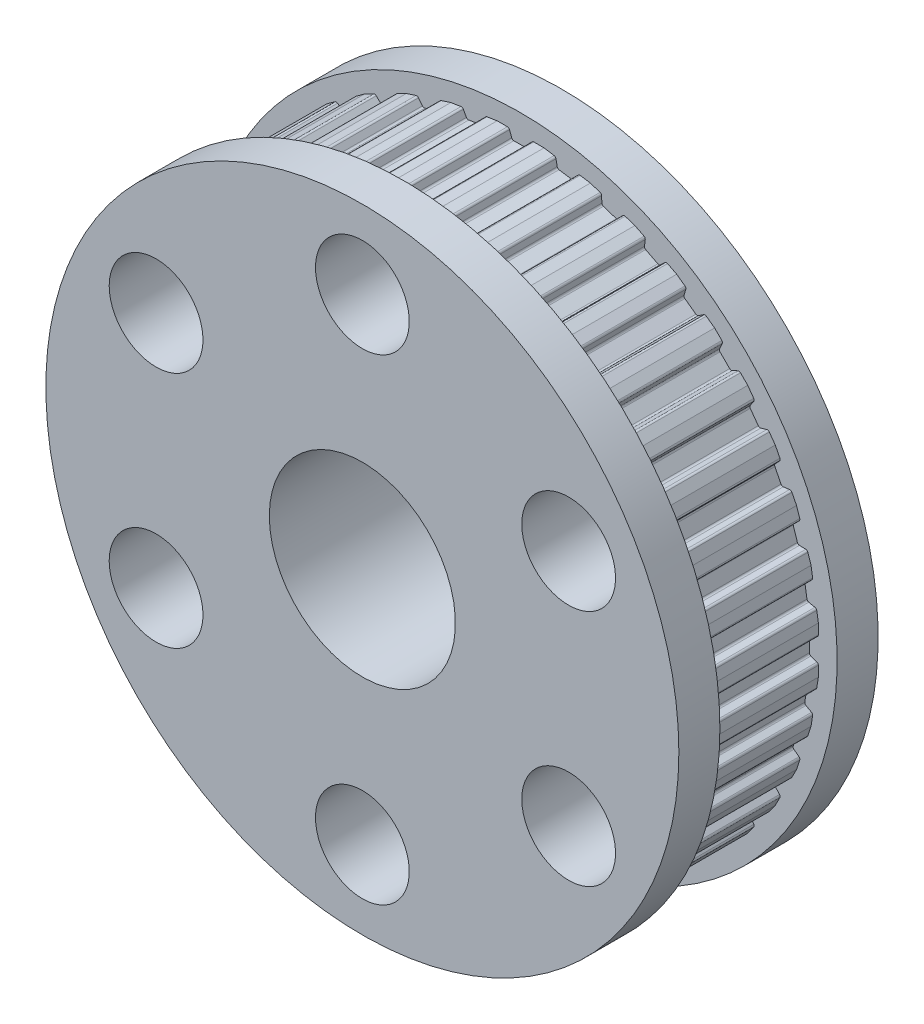
from build123d import *

# Parameters (mm, degrees)
BOSS_EXTRUDE1_DEPTH         = 5
SKETCH3_R                   = 13.5
BOSS_EXTRUDE2_DEPTH         = 1.75
BOSS_EXTRUDE3_START         = 1.75
SKETCH4_R                   = 13.5
BOSS_EXTRUDE3_DEPTH         = 1.75
F_5_16_0_3125_DOWEL_HOLE2_D = 7.9375
F_4_0MM_DOWEL_HOLE1_D       = 4
CIRPATTERN1_COUNT           = 6


with BuildPart() as part:
    # Sketch1 → Boss-Extrude1 (new body)
    with BuildSketch(Plane.XY):
        with BuildLine():
            Line((-50.783511677, 0), (-50.346633156, 0))
            ThreePointArc((-50.346633156, 0), (-50.292, 0.017225768), (-50.257127433, 0.062672581))
            Line((-50.257127433, 0.062672581), (-50.164076682, 0.318327419))
            ThreePointArc((-50.164076682, 0.318327419), (-50.129204116, 0.363774232), (-50.07457096, 0.381))
            Line((-50.07457096, 0.381), (-49.49342904, 0.381))
            ThreePointArc((-49.49342904, 0.381), (-49.438795884, 0.363774232), (-49.403923318, 0.318327419))
            Line((-49.403923318, 0.318327419), (-49.310872567, 0.062672581))
            ThreePointArc((-49.310872567, 0.062672581), (-49.276, 0.017225768), (-49.221366844, 0))
            Line((-49.221366844, 0), (-48.784488323, 0))
            Line((-48.784488323, 0), (-48.352988502, 0.068342858))
            ThreePointArc((-48.352988502, 0.068342858), (-48.301722675, 0.093903056), (-48.274388895, 0.144245615))
            Line((-48.274388895, 0.144245615), (-48.222476981, 0.411309262))
            ThreePointArc((-48.222476981, 0.411309262), (-48.195143202, 0.461651821), (-48.143877375, 0.487212019))
            Line((-48.143877375, 0.487212019), (-47.569890276, 0.578122645))
            ThreePointArc((-47.569890276, 0.578122645), (-47.513235041, 0.569655463), (-47.471682366, 0.530223447))
            Line((-47.471682366, 0.530223447), (-47.339783996, 0.292272489))
            ThreePointArc((-47.339783996, 0.292272489), (-47.298231321, 0.252840473), (-47.241576086, 0.244373291))
            Line((-47.241576086, 0.244373291), (-46.810076265, 0.312716149))
            Line((-46.810076265, 0.312716149), (-46.3945801, 0.447719036))
            ThreePointArc((-46.3945801, 0.447719036), (-46.347943937, 0.480984289), (-46.328821993, 0.534982993))
            Line((-46.328821993, 0.534982993), (-46.319327159, 0.806879455))
            ThreePointArc((-46.319327159, 0.806879455), (-46.300205215, 0.860878159), (-46.253569052, 0.894143411))
            Line((-46.253569052, 0.894143411), (-45.700870241, 1.073726141))
            ThreePointArc((-45.700870241, 1.073726141), (-45.643587967, 1.074226035), (-45.596378348, 1.041779763))
            Line((-45.596378348, 1.041779763), (-45.428880136, 0.827391827))
            ThreePointArc((-45.428880136, 0.827391827), (-45.381670516, 0.794945555), (-45.324388243, 0.79544545))
            Line((-45.324388243, 0.79544545), (-44.908892078, 0.930448337))
            Line((-44.908892078, 0.930448337), (-44.519630466, 1.128787035))
            ThreePointArc((-44.519630466, 1.128787035), (-44.478772303, 1.16893824), (-44.46833304, 1.225263462))
            Line((-44.46833304, 1.225263462), (-44.501489081, 1.495297747))
            ThreePointArc((-44.501489081, 1.495297747), (-44.491049818, 1.551622968), (-44.450191655, 1.591774173))
            Line((-44.450191655, 1.591774173), (-43.932390412, 1.855607084))
            ThreePointArc((-43.932390412, 1.855607084), (-43.875891579, 1.865061746), (-43.824187473, 1.840400153))
            Line((-43.824187473, 1.840400153), (-43.62521378, 1.654854182))
            ThreePointArc((-43.62521378, 1.654854182), (-43.573509674, 1.630192588), (-43.517010841, 1.63964725))
            Line((-43.517010841, 1.63964725), (-43.127749228, 1.837985948))
            Line((-43.127749228, 1.837985948), (-42.77430708, 2.0947767))
            ThreePointArc((-42.77430708, 2.0947767), (-42.740232981, 2.140825202), (-42.738733449, 2.198090027))
            Line((-42.738733449, 2.198090027), (-42.813723953, 2.459612994))
            ThreePointArc((-42.813723953, 2.459612994), (-42.812224421, 2.516877819), (-42.778150322, 2.562926321))
            Line((-42.778150322, 2.562926321), (-42.307996632, 2.904512971))
            ThreePointArc((-42.307996632, 2.904512971), (-42.253672429, 2.922689596), (-42.198746963, 2.906419932))
            Line((-42.198746963, 2.906419932), (-41.973197181, 2.754284683))
            ThreePointArc((-41.973197181, 2.754284683), (-41.918271715, 2.738015018), (-41.863947511, 2.756191643))
            Line((-41.863947511, 2.756191643), (-41.510505363, 3.012982394))
            Line((-41.510505363, 3.012982394), (-41.201585599, 3.321902159))
            ThreePointArc((-41.201585599, 3.321902159), (-41.175134581, 3.372714091), (-41.182611703, 3.42950847))
            Line((-41.182611703, 3.42950847), (-41.297590155, 3.676080556))
            ThreePointArc((-41.297590155, 3.676080556), (-41.305067277, 3.732874934), (-41.278616259, 3.783686866))
            Line((-41.278616259, 3.783686866), (-40.867686866, 4.194616259))
            ThreePointArc((-40.867686866, 4.194616259), (-40.816874934, 4.221067277), (-40.760080556, 4.213590155))
            Line((-40.760080556, 4.213590155), (-40.51350847, 4.098611703))
            ThreePointArc((-40.51350847, 4.098611703), (-40.456714091, 4.091134581), (-40.405902159, 4.117585599))
            Line((-40.405902159, 4.117585599), (-40.096982394, 4.426505363))
            Line((-40.096982394, 4.426505363), (-39.840191643, 4.779947511))
            ThreePointArc((-39.840191643, 4.779947511), (-39.822015018, 4.834271715), (-39.838284683, 4.889197181))
            Line((-39.838284683, 4.889197181), (-39.990419932, 5.114746963))
            ThreePointArc((-39.990419932, 5.114746963), (-40.006689596, 5.169672429), (-39.988512971, 5.223996632))
            Line((-39.988512971, 5.223996632), (-39.646926321, 5.694150322))
            ThreePointArc((-39.646926321, 5.694150322), (-39.600877819, 5.728224421), (-39.543612994, 5.729723953))
            Line((-39.543612994, 5.729723953), (-39.282090027, 5.654733449))
            ThreePointArc((-39.282090027, 5.654733449), (-39.224825202, 5.656232981), (-39.1787767, 5.69030708))
            Line((-39.1787767, 5.69030708), (-38.921985948, 6.043749228))
            Line((-38.921985948, 6.043749228), (-38.72364725, 6.433010841))
            ThreePointArc((-38.72364725, 6.433010841), (-38.714192588, 6.489509674), (-38.738854182, 6.54121378))
            Line((-38.738854182, 6.54121378), (-38.924400153, 6.740187473))
            ThreePointArc((-38.924400153, 6.740187473), (-38.949061746, 6.791891579), (-38.939607084, 6.848390412))
            Line((-38.939607084, 6.848390412), (-38.675774173, 7.366191655))
            ThreePointArc((-38.675774173, 7.366191655), (-38.635622968, 7.407049818), (-38.579297747, 7.417489081))
            Line((-38.579297747, 7.417489081), (-38.309263462, 7.38433304))
            ThreePointArc((-38.309263462, 7.38433304), (-38.25293824, 7.394772303), (-38.212787035, 7.435630466))
            Line((-38.212787035, 7.435630466), (-38.014448337, 7.824892078))
            Line((-38.014448337, 7.824892078), (-37.87944545, 8.240388243))
            ThreePointArc((-37.87944545, 8.240388243), (-37.878945555, 8.297670516), (-37.911391827, 8.344880136))
            Line((-37.911391827, 8.344880136), (-38.125779763, 8.512378348))
            ThreePointArc((-38.125779763, 8.512378348), (-38.158226035, 8.559587967), (-38.157726141, 8.616870241))
            Line((-38.157726141, 8.616870241), (-37.978143411, 9.169569052))
            ThreePointArc((-37.978143411, 9.169569052), (-37.944878159, 9.216205215), (-37.890879455, 9.235327159))
            Line((-37.890879455, 9.235327159), (-37.618982993, 9.244821993))
            ThreePointArc((-37.618982993, 9.244821993), (-37.564984289, 9.263943937), (-37.531719036, 9.3105801))
            Line((-37.531719036, 9.3105801), (-37.396716149, 9.726076265))
            Line((-37.396716149, 9.726076265), (-37.328373291, 10.157576086))
            ThreePointArc((-37.328373291, 10.157576086), (-37.336840473, 10.214231321), (-37.376272489, 10.255783996))
            Line((-37.376272489, 10.255783996), (-37.614223447, 10.387682366))
            ThreePointArc((-37.614223447, 10.387682366), (-37.653655463, 10.429235041), (-37.662122645, 10.485890276))
            Line((-37.662122645, 10.485890276), (-37.571212019, 11.059877375))
            ThreePointArc((-37.571212019, 11.059877375), (-37.545651821, 11.111143202), (-37.495309262, 11.138476981))
            Line((-37.495309262, 11.138476981), (-37.228245615, 11.190388895))
            ThreePointArc((-37.228245615, 11.190388895), (-37.177903056, 11.217722675), (-37.152342858, 11.268988502))
            Line((-37.152342858, 11.268988502), (-37.084, 11.700488323))
            Line((-37.084, 11.700488323), (-37.084, 12.137366844))
            ThreePointArc((-37.084, 12.137366844), (-37.101225768, 12.192), (-37.146672581, 12.226872567))
            Line((-37.146672581, 12.226872567), (-37.402327419, 12.319923318))
            ThreePointArc((-37.402327419, 12.319923318), (-37.447774232, 12.354795884), (-37.465, 12.40942904))
            Line((-37.465, 12.40942904), (-37.465, 12.99057096))
            ThreePointArc((-37.465, 12.99057096), (-37.447774232, 13.045204116), (-37.402327419, 13.080076682))
            Line((-37.402327419, 13.080076682), (-37.146672581, 13.173127433))
            ThreePointArc((-37.146672581, 13.173127433), (-37.101225768, 13.208), (-37.084, 13.262633156))
            Line((-37.084, 13.262633156), (-37.084, 13.699511677))
            Line((-37.084, 13.699511677), (-37.152342858, 14.131011498))
            ThreePointArc((-37.152342858, 14.131011498), (-37.177903056, 14.182277325), (-37.228245615, 14.209611105))
            Line((-37.228245615, 14.209611105), (-37.495309262, 14.261523019))
            ThreePointArc((-37.495309262, 14.261523019), (-37.545651821, 14.288856798), (-37.571212019, 14.340122625))
            Line((-37.571212019, 14.340122625), (-37.662122645, 14.914109724))
            ThreePointArc((-37.662122645, 14.914109724), (-37.653655463, 14.970764959), (-37.614223447, 15.012317634))
            Line((-37.614223447, 15.012317634), (-37.376272489, 15.144216004))
            ThreePointArc((-37.376272489, 15.144216004), (-37.336840473, 15.185768679), (-37.328373291, 15.242423914))
            Line((-37.328373291, 15.242423914), (-37.396716149, 15.673923735))
            Line((-37.396716149, 15.673923735), (-37.531719036, 16.0894199))
            ThreePointArc((-37.531719036, 16.0894199), (-37.564984289, 16.136056063), (-37.618982993, 16.155178007))
            Line((-37.618982993, 16.155178007), (-37.890879455, 16.164672841))
            ThreePointArc((-37.890879455, 16.164672841), (-37.944878159, 16.183794785), (-37.978143411, 16.230430948))
            Line((-37.978143411, 16.230430948), (-38.157726141, 16.783129759))
            ThreePointArc((-38.157726141, 16.783129759), (-38.158226035, 16.840412033), (-38.125779763, 16.887621652))
            Line((-38.125779763, 16.887621652), (-37.911391827, 17.055119864))
            ThreePointArc((-37.911391827, 17.055119864), (-37.878945555, 17.102329484), (-37.87944545, 17.159611757))
            Line((-37.87944545, 17.159611757), (-38.014448337, 17.575107922))
            Line((-38.014448337, 17.575107922), (-38.212787035, 17.964369534))
            ThreePointArc((-38.212787035, 17.964369534), (-38.25293824, 18.005227697), (-38.309263462, 18.01566696))
            Line((-38.309263462, 18.01566696), (-38.579297747, 17.982510919))
            ThreePointArc((-38.579297747, 17.982510919), (-38.635622968, 17.992950182), (-38.675774173, 18.033808345))
            Line((-38.675774173, 18.033808345), (-38.939607084, 18.551609588))
            ThreePointArc((-38.939607084, 18.551609588), (-38.949061746, 18.608108421), (-38.924400153, 18.659812527))
            Line((-38.924400153, 18.659812527), (-38.738854182, 18.85878622))
            ThreePointArc((-38.738854182, 18.85878622), (-38.714192588, 18.910490326), (-38.72364725, 18.966989159))
            Line((-38.72364725, 18.966989159), (-38.921985948, 19.356250772))
            Line((-38.921985948, 19.356250772), (-39.1787767, 19.70969292))
            ThreePointArc((-39.1787767, 19.70969292), (-39.224825202, 19.743767019), (-39.282090027, 19.745266551))
            Line((-39.282090027, 19.745266551), (-39.543612994, 19.670276047))
            ThreePointArc((-39.543612994, 19.670276047), (-39.600877819, 19.671775579), (-39.646926321, 19.705849678))
            Line((-39.646926321, 19.705849678), (-39.988512971, 20.176003368))
            ThreePointArc((-39.988512971, 20.176003368), (-40.006689596, 20.230327571), (-39.990419932, 20.285253037))
            Line((-39.990419932, 20.285253037), (-39.838284683, 20.510802819))
            ThreePointArc((-39.838284683, 20.510802819), (-39.822015018, 20.565728285), (-39.840191643, 20.620052489))
            Line((-39.840191643, 20.620052489), (-40.096982394, 20.973494637))
            Line((-40.096982394, 20.973494637), (-40.405902159, 21.282414401))
            ThreePointArc((-40.405902159, 21.282414401), (-40.456714091, 21.308865419), (-40.51350847, 21.301388297))
            Line((-40.51350847, 21.301388297), (-40.760080556, 21.186409845))
            ThreePointArc((-40.760080556, 21.186409845), (-40.816874934, 21.178932723), (-40.867686866, 21.205383741))
            Line((-40.867686866, 21.205383741), (-41.278616259, 21.616313134))
            ThreePointArc((-41.278616259, 21.616313134), (-41.305067277, 21.667125066), (-41.297590155, 21.723919444))
            Line((-41.297590155, 21.723919444), (-41.182611703, 21.97049153))
            ThreePointArc((-41.182611703, 21.97049153), (-41.175134581, 22.027285909), (-41.201585599, 22.078097841))
            Line((-41.201585599, 22.078097841), (-41.510505363, 22.387017606))
            Line((-41.510505363, 22.387017606), (-41.863947511, 22.643808357))
            ThreePointArc((-41.863947511, 22.643808357), (-41.918271715, 22.661984982), (-41.973197181, 22.645715317))
            Line((-41.973197181, 22.645715317), (-42.198746963, 22.493580068))
            ThreePointArc((-42.198746963, 22.493580068), (-42.253672429, 22.477310404), (-42.307996632, 22.495487029))
            Line((-42.307996632, 22.495487029), (-42.778150322, 22.837073679))
            ThreePointArc((-42.778150322, 22.837073679), (-42.812224421, 22.883122181), (-42.813723953, 22.940387006))
            Line((-42.813723953, 22.940387006), (-42.738733449, 23.201909973))
            ThreePointArc((-42.738733449, 23.201909973), (-42.740232981, 23.259174798), (-42.77430708, 23.3052233))
            Line((-42.77430708, 23.3052233), (-43.127749228, 23.562014052))
            Line((-43.127749228, 23.562014052), (-43.517010841, 23.76035275))
            ThreePointArc((-43.517010841, 23.76035275), (-43.573509674, 23.769807412), (-43.62521378, 23.745145818))
            Line((-43.62521378, 23.745145818), (-43.824187473, 23.559599847))
            ThreePointArc((-43.824187473, 23.559599847), (-43.875891579, 23.534938254), (-43.932390412, 23.544392916))
            Line((-43.932390412, 23.544392916), (-44.450191655, 23.808225827))
            ThreePointArc((-44.450191655, 23.808225827), (-44.491049818, 23.848377032), (-44.501489081, 23.904702253))
            Line((-44.501489081, 23.904702253), (-44.46833304, 24.174736538))
            ThreePointArc((-44.46833304, 24.174736538), (-44.478772303, 24.23106176), (-44.519630466, 24.271212965))
            Line((-44.519630466, 24.271212965), (-44.908892078, 24.469551663))
            Line((-44.908892078, 24.469551663), (-45.324388243, 24.60455455))
            ThreePointArc((-45.324388243, 24.60455455), (-45.381670516, 24.605054445), (-45.428880136, 24.572608173))
            Line((-45.428880136, 24.572608173), (-45.596378348, 24.358220237))
            ThreePointArc((-45.596378348, 24.358220237), (-45.643587967, 24.325773965), (-45.700870241, 24.326273859))
            Line((-45.700870241, 24.326273859), (-46.253569052, 24.505856589))
            ThreePointArc((-46.253569052, 24.505856589), (-46.300205215, 24.539121841), (-46.319327159, 24.593120545))
            Line((-46.319327159, 24.593120545), (-46.328821993, 24.865017007))
            ThreePointArc((-46.328821993, 24.865017007), (-46.347943937, 24.919015711), (-46.3945801, 24.952280964))
            Line((-46.3945801, 24.952280964), (-46.810076265, 25.087283851))
            Line((-46.810076265, 25.087283851), (-47.241576086, 25.155626709))
            ThreePointArc((-47.241576086, 25.155626709), (-47.298231321, 25.147159527), (-47.339783996, 25.107727511))
            Line((-47.339783996, 25.107727511), (-47.471682366, 24.869776553))
            ThreePointArc((-47.471682366, 24.869776553), (-47.513235041, 24.830344537), (-47.569890276, 24.821877355))
            Line((-47.569890276, 24.821877355), (-48.143877375, 24.912787981))
            ThreePointArc((-48.143877375, 24.912787981), (-48.195143202, 24.938348179), (-48.222476981, 24.988690738))
            Line((-48.222476981, 24.988690738), (-48.274388895, 25.255754385))
            ThreePointArc((-48.274388895, 25.255754385), (-48.301722675, 25.306096944), (-48.352988502, 25.331657142))
            Line((-48.352988502, 25.331657142), (-48.784488323, 25.4))
            Line((-48.784488323, 25.4), (-49.221366844, 25.4))
            ThreePointArc((-49.221366844, 25.4), (-49.276, 25.382774232), (-49.310872567, 25.337327419))
            Line((-49.310872567, 25.337327419), (-49.403923318, 25.081672581))
            ThreePointArc((-49.403923318, 25.081672581), (-49.438795884, 25.036225768), (-49.49342904, 25.019))
            Line((-49.49342904, 25.019), (-50.07457096, 25.019))
            ThreePointArc((-50.07457096, 25.019), (-50.129204116, 25.036225768), (-50.164076682, 25.081672581))
            Line((-50.164076682, 25.081672581), (-50.257127433, 25.337327419))
            ThreePointArc((-50.257127433, 25.337327419), (-50.292, 25.382774232), (-50.346633156, 25.4))
            Line((-50.346633156, 25.4), (-50.783511677, 25.4))
            Line((-50.783511677, 25.4), (-51.215011498, 25.331657142))
            ThreePointArc((-51.215011498, 25.331657142), (-51.266277325, 25.306096944), (-51.293611105, 25.255754385))
            Line((-51.293611105, 25.255754385), (-51.345523019, 24.988690738))
            ThreePointArc((-51.345523019, 24.988690738), (-51.372856798, 24.938348179), (-51.424122625, 24.912787981))
            Line((-51.424122625, 24.912787981), (-51.998109724, 24.821877355))
            ThreePointArc((-51.998109724, 24.821877355), (-52.054764959, 24.830344537), (-52.096317634, 24.869776553))
            Line((-52.096317634, 24.869776553), (-52.228216004, 25.107727511))
            ThreePointArc((-52.228216004, 25.107727511), (-52.269768679, 25.147159527), (-52.326423914, 25.155626709))
            Line((-52.326423914, 25.155626709), (-52.757923735, 25.087283851))
            Line((-52.757923735, 25.087283851), (-53.1734199, 24.952280964))
            ThreePointArc((-53.1734199, 24.952280964), (-53.220056063, 24.919015711), (-53.239178007, 24.865017007))
            Line((-53.239178007, 24.865017007), (-53.248672841, 24.593120545))
            ThreePointArc((-53.248672841, 24.593120545), (-53.267794785, 24.539121841), (-53.314430948, 24.505856589))
            Line((-53.314430948, 24.505856589), (-53.867129759, 24.326273859))
            ThreePointArc((-53.867129759, 24.326273859), (-53.924412033, 24.325773965), (-53.971621652, 24.358220237))
            Line((-53.971621652, 24.358220237), (-54.139119864, 24.572608173))
            ThreePointArc((-54.139119864, 24.572608173), (-54.186329484, 24.605054445), (-54.243611757, 24.60455455))
            Line((-54.243611757, 24.60455455), (-54.659107922, 24.469551663))
            Line((-54.659107922, 24.469551663), (-55.048369534, 24.271212965))
            ThreePointArc((-55.048369534, 24.271212965), (-55.089227697, 24.23106176), (-55.09966696, 24.174736538))
            Line((-55.09966696, 24.174736538), (-55.066510919, 23.904702253))
            ThreePointArc((-55.066510919, 23.904702253), (-55.076950182, 23.848377032), (-55.117808345, 23.808225827))
            Line((-55.117808345, 23.808225827), (-55.635609588, 23.544392916))
            ThreePointArc((-55.635609588, 23.544392916), (-55.692108421, 23.534938254), (-55.743812527, 23.559599847))
            Line((-55.743812527, 23.559599847), (-55.94278622, 23.745145818))
            ThreePointArc((-55.94278622, 23.745145818), (-55.994490326, 23.769807412), (-56.050989159, 23.76035275))
            Line((-56.050989159, 23.76035275), (-56.440250772, 23.562014052))
            Line((-56.440250772, 23.562014052), (-56.79369292, 23.3052233))
            ThreePointArc((-56.79369292, 23.3052233), (-56.827767019, 23.259174798), (-56.829266551, 23.201909973))
            Line((-56.829266551, 23.201909973), (-56.754276047, 22.940387006))
            ThreePointArc((-56.754276047, 22.940387006), (-56.755775579, 22.883122181), (-56.789849678, 22.837073679))
            Line((-56.789849678, 22.837073679), (-57.260003368, 22.495487029))
            ThreePointArc((-57.260003368, 22.495487029), (-57.314327571, 22.477310404), (-57.369253037, 22.493580068))
            Line((-57.369253037, 22.493580068), (-57.594802819, 22.645715317))
            ThreePointArc((-57.594802819, 22.645715317), (-57.649728285, 22.661984982), (-57.704052489, 22.643808357))
            Line((-57.704052489, 22.643808357), (-58.057494637, 22.387017606))
            Line((-58.057494637, 22.387017606), (-58.366414401, 22.078097841))
            ThreePointArc((-58.366414401, 22.078097841), (-58.392865419, 22.027285909), (-58.385388297, 21.97049153))
            Line((-58.385388297, 21.97049153), (-58.270409845, 21.723919444))
            ThreePointArc((-58.270409845, 21.723919444), (-58.262932723, 21.667125066), (-58.289383741, 21.616313134))
            Line((-58.289383741, 21.616313134), (-58.700313134, 21.205383741))
            ThreePointArc((-58.700313134, 21.205383741), (-58.751125066, 21.178932723), (-58.807919444, 21.186409845))
            Line((-58.807919444, 21.186409845), (-59.05449153, 21.301388297))
            ThreePointArc((-59.05449153, 21.301388297), (-59.111285909, 21.308865419), (-59.162097841, 21.282414401))
            Line((-59.162097841, 21.282414401), (-59.471017606, 20.973494637))
            Line((-59.471017606, 20.973494637), (-59.727808357, 20.620052489))
            ThreePointArc((-59.727808357, 20.620052489), (-59.745984982, 20.565728285), (-59.729715317, 20.510802819))
            Line((-59.729715317, 20.510802819), (-59.577580068, 20.285253037))
            ThreePointArc((-59.577580068, 20.285253037), (-59.561310404, 20.230327571), (-59.579487029, 20.176003368))
            Line((-59.579487029, 20.176003368), (-59.921073679, 19.705849678))
            ThreePointArc((-59.921073679, 19.705849678), (-59.967122181, 19.671775579), (-60.024387006, 19.670276047))
            Line((-60.024387006, 19.670276047), (-60.285909973, 19.745266551))
            ThreePointArc((-60.285909973, 19.745266551), (-60.343174798, 19.743767019), (-60.3892233, 19.70969292))
            Line((-60.3892233, 19.70969292), (-60.646014052, 19.356250772))
            Line((-60.646014052, 19.356250772), (-60.84435275, 18.966989159))
            ThreePointArc((-60.84435275, 18.966989159), (-60.853807412, 18.910490326), (-60.829145818, 18.85878622))
            Line((-60.829145818, 18.85878622), (-60.643599847, 18.659812527))
            ThreePointArc((-60.643599847, 18.659812527), (-60.618938254, 18.608108421), (-60.628392916, 18.551609588))
            Line((-60.628392916, 18.551609588), (-60.892225827, 18.033808345))
            ThreePointArc((-60.892225827, 18.033808345), (-60.932377032, 17.992950182), (-60.988702253, 17.982510919))
            Line((-60.988702253, 17.982510919), (-61.258736538, 18.01566696))
            ThreePointArc((-61.258736538, 18.01566696), (-61.31506176, 18.005227697), (-61.355212965, 17.964369534))
            Line((-61.355212965, 17.964369534), (-61.553551663, 17.575107922))
            Line((-61.553551663, 17.575107922), (-61.68855455, 17.159611757))
            ThreePointArc((-61.68855455, 17.159611757), (-61.689054445, 17.102329484), (-61.656608173, 17.055119864))
            Line((-61.656608173, 17.055119864), (-61.442220237, 16.887621652))
            ThreePointArc((-61.442220237, 16.887621652), (-61.409773965, 16.840412033), (-61.410273859, 16.783129759))
            Line((-61.410273859, 16.783129759), (-61.589856589, 16.230430948))
            ThreePointArc((-61.589856589, 16.230430948), (-61.623121841, 16.183794785), (-61.677120545, 16.164672841))
            Line((-61.677120545, 16.164672841), (-61.949017007, 16.155178007))
            ThreePointArc((-61.949017007, 16.155178007), (-62.003015711, 16.136056063), (-62.036280964, 16.0894199))
            Line((-62.036280964, 16.0894199), (-62.171283851, 15.673923735))
            Line((-62.171283851, 15.673923735), (-62.239626709, 15.242423914))
            ThreePointArc((-62.239626709, 15.242423914), (-62.231159527, 15.185768679), (-62.191727511, 15.144216004))
            Line((-62.191727511, 15.144216004), (-61.953776553, 15.012317634))
            ThreePointArc((-61.953776553, 15.012317634), (-61.914344537, 14.970764959), (-61.905877355, 14.914109724))
            Line((-61.905877355, 14.914109724), (-61.996787981, 14.340122625))
            ThreePointArc((-61.996787981, 14.340122625), (-62.022348179, 14.288856798), (-62.072690738, 14.261523019))
            Line((-62.072690738, 14.261523019), (-62.339754385, 14.209611105))
            ThreePointArc((-62.339754385, 14.209611105), (-62.390096944, 14.182277325), (-62.415657142, 14.131011498))
            Line((-62.415657142, 14.131011498), (-62.484, 13.699511677))
            Line((-62.484, 13.699511677), (-62.484, 13.262633156))
            ThreePointArc((-62.484, 13.262633156), (-62.466774232, 13.208), (-62.421327419, 13.173127433))
            Line((-62.421327419, 13.173127433), (-62.165672581, 13.080076682))
            ThreePointArc((-62.165672581, 13.080076682), (-62.120225768, 13.045204116), (-62.103, 12.99057096))
            Line((-62.103, 12.99057096), (-62.103, 12.40942904))
            ThreePointArc((-62.103, 12.40942904), (-62.120225768, 12.354795884), (-62.165672581, 12.319923318))
            Line((-62.165672581, 12.319923318), (-62.421327419, 12.226872567))
            ThreePointArc((-62.421327419, 12.226872567), (-62.466774232, 12.192), (-62.484, 12.137366844))
            Line((-62.484, 12.137366844), (-62.484, 11.700488323))
            Line((-62.484, 11.700488323), (-62.415657142, 11.268988502))
            ThreePointArc((-62.415657142, 11.268988502), (-62.390096944, 11.217722675), (-62.339754385, 11.190388895))
            Line((-62.339754385, 11.190388895), (-62.072690738, 11.138476981))
            ThreePointArc((-62.072690738, 11.138476981), (-62.022348179, 11.111143202), (-61.996787981, 11.059877375))
            Line((-61.996787981, 11.059877375), (-61.905877355, 10.485890276))
            ThreePointArc((-61.905877355, 10.485890276), (-61.914344537, 10.429235041), (-61.953776553, 10.387682366))
            Line((-61.953776553, 10.387682366), (-62.191727511, 10.255783996))
            ThreePointArc((-62.191727511, 10.255783996), (-62.231159527, 10.214231321), (-62.239626709, 10.157576086))
            Line((-62.239626709, 10.157576086), (-62.171283851, 9.726076265))
            Line((-62.171283851, 9.726076265), (-62.036280964, 9.3105801))
            ThreePointArc((-62.036280964, 9.3105801), (-62.003015711, 9.263943937), (-61.949017007, 9.244821993))
            Line((-61.949017007, 9.244821993), (-61.677120545, 9.235327159))
            ThreePointArc((-61.677120545, 9.235327159), (-61.623121841, 9.216205215), (-61.589856589, 9.169569052))
            Line((-61.589856589, 9.169569052), (-61.410273859, 8.616870241))
            ThreePointArc((-61.410273859, 8.616870241), (-61.409773965, 8.559587967), (-61.442220237, 8.512378348))
            Line((-61.442220237, 8.512378348), (-61.656608173, 8.344880136))
            ThreePointArc((-61.656608173, 8.344880136), (-61.689054445, 8.297670516), (-61.68855455, 8.240388243))
            Line((-61.68855455, 8.240388243), (-61.553551663, 7.824892078))
            Line((-61.553551663, 7.824892078), (-61.355212965, 7.435630466))
            ThreePointArc((-61.355212965, 7.435630466), (-61.31506176, 7.394772303), (-61.258736538, 7.38433304))
            Line((-61.258736538, 7.38433304), (-60.988702253, 7.417489081))
            ThreePointArc((-60.988702253, 7.417489081), (-60.932377032, 7.407049818), (-60.892225827, 7.366191655))
            Line((-60.892225827, 7.366191655), (-60.628392916, 6.848390412))
            ThreePointArc((-60.628392916, 6.848390412), (-60.618938254, 6.791891579), (-60.643599847, 6.740187473))
            Line((-60.643599847, 6.740187473), (-60.829145818, 6.54121378))
            ThreePointArc((-60.829145818, 6.54121378), (-60.853807412, 6.489509674), (-60.84435275, 6.433010841))
            Line((-60.84435275, 6.433010841), (-60.646014052, 6.043749228))
            Line((-60.646014052, 6.043749228), (-60.3892233, 5.69030708))
            ThreePointArc((-60.3892233, 5.69030708), (-60.343174798, 5.656232981), (-60.285909973, 5.654733449))
            Line((-60.285909973, 5.654733449), (-60.024387006, 5.729723953))
            ThreePointArc((-60.024387006, 5.729723953), (-59.967122181, 5.728224421), (-59.921073679, 5.694150322))
            Line((-59.921073679, 5.694150322), (-59.579487029, 5.223996632))
            ThreePointArc((-59.579487029, 5.223996632), (-59.561310404, 5.169672429), (-59.577580068, 5.114746963))
            Line((-59.577580068, 5.114746963), (-59.729715317, 4.889197181))
            ThreePointArc((-59.729715317, 4.889197181), (-59.745984982, 4.834271715), (-59.727808357, 4.779947511))
            Line((-59.727808357, 4.779947511), (-59.471017606, 4.426505363))
            Line((-59.471017606, 4.426505363), (-59.162097841, 4.117585599))
            ThreePointArc((-59.162097841, 4.117585599), (-59.111285909, 4.091134581), (-59.05449153, 4.098611703))
            Line((-59.05449153, 4.098611703), (-58.807919444, 4.213590155))
            ThreePointArc((-58.807919444, 4.213590155), (-58.751125066, 4.221067277), (-58.700313134, 4.194616259))
            Line((-58.700313134, 4.194616259), (-58.289383741, 3.783686866))
            ThreePointArc((-58.289383741, 3.783686866), (-58.262932723, 3.732874934), (-58.270409845, 3.676080556))
            Line((-58.270409845, 3.676080556), (-58.385388297, 3.42950847))
            ThreePointArc((-58.385388297, 3.42950847), (-58.392865419, 3.372714091), (-58.366414401, 3.321902159))
            Line((-58.366414401, 3.321902159), (-58.057494637, 3.012982394))
            Line((-58.057494637, 3.012982394), (-57.704052489, 2.756191643))
            ThreePointArc((-57.704052489, 2.756191643), (-57.649728285, 2.738015018), (-57.594802819, 2.754284683))
            Line((-57.594802819, 2.754284683), (-57.369253037, 2.906419932))
            ThreePointArc((-57.369253037, 2.906419932), (-57.314327571, 2.922689596), (-57.260003368, 2.904512971))
            Line((-57.260003368, 2.904512971), (-56.789849678, 2.562926321))
            ThreePointArc((-56.789849678, 2.562926321), (-56.755775579, 2.516877819), (-56.754276047, 2.459612994))
            Line((-56.754276047, 2.459612994), (-56.829266551, 2.198090027))
            ThreePointArc((-56.829266551, 2.198090027), (-56.827767019, 2.140825202), (-56.79369292, 2.0947767))
            Line((-56.79369292, 2.0947767), (-56.440250772, 1.837985948))
            Line((-56.440250772, 1.837985948), (-56.050989159, 1.63964725))
            ThreePointArc((-56.050989159, 1.63964725), (-55.994490326, 1.630192588), (-55.94278622, 1.654854182))
            Line((-55.94278622, 1.654854182), (-55.743812527, 1.840400153))
            ThreePointArc((-55.743812527, 1.840400153), (-55.692108421, 1.865061746), (-55.635609588, 1.855607084))
            Line((-55.635609588, 1.855607084), (-55.117808345, 1.591774173))
            ThreePointArc((-55.117808345, 1.591774173), (-55.076950182, 1.551622968), (-55.066510919, 1.495297747))
            Line((-55.066510919, 1.495297747), (-55.09966696, 1.225263462))
            ThreePointArc((-55.09966696, 1.225263462), (-55.089227697, 1.16893824), (-55.048369534, 1.128787035))
            Line((-55.048369534, 1.128787035), (-54.659107922, 0.930448337))
            Line((-54.659107922, 0.930448337), (-54.243611757, 0.79544545))
            ThreePointArc((-54.243611757, 0.79544545), (-54.186329484, 0.794945555), (-54.139119864, 0.827391827))
            Line((-54.139119864, 0.827391827), (-53.971621652, 1.041779763))
            ThreePointArc((-53.971621652, 1.041779763), (-53.924412033, 1.074226035), (-53.867129759, 1.073726141))
            Line((-53.867129759, 1.073726141), (-53.314430948, 0.894143411))
            ThreePointArc((-53.314430948, 0.894143411), (-53.267794785, 0.860878159), (-53.248672841, 0.806879455))
            Line((-53.248672841, 0.806879455), (-53.239178007, 0.534982993))
            ThreePointArc((-53.239178007, 0.534982993), (-53.220056063, 0.480984289), (-53.1734199, 0.447719036))
            Line((-53.1734199, 0.447719036), (-52.757923735, 0.312716149))
            Line((-52.757923735, 0.312716149), (-52.326423914, 0.244373291))
            ThreePointArc((-52.326423914, 0.244373291), (-52.269768679, 0.252840473), (-52.228216004, 0.292272489))
            Line((-52.228216004, 0.292272489), (-52.096317634, 0.530223447))
            ThreePointArc((-52.096317634, 0.530223447), (-52.054764959, 0.569655463), (-51.998109724, 0.578122645))
            Line((-51.998109724, 0.578122645), (-51.424122625, 0.487212019))
            ThreePointArc((-51.424122625, 0.487212019), (-51.372856798, 0.461651821), (-51.345523019, 0.411309262))
            Line((-51.345523019, 0.411309262), (-51.293611105, 0.144245615))
            ThreePointArc((-51.293611105, 0.144245615), (-51.266277325, 0.093903056), (-51.215011498, 0.068342858))
            Line((-51.215011498, 0.068342858), (-50.783511677, 0))
        make_face()
    extrude(amount=BOSS_EXTRUDE1_DEPTH)

    # Sketch3 → Boss-Extrude2 (add)
    with BuildSketch(Plane.XY.offset(5)):
        with Locations((-49.784, 12.7)):
            Circle(SKETCH3_R)
    extrude(amount=BOSS_EXTRUDE2_DEPTH)

    # Sketch4 → Boss-Extrude3 (add)
    with BuildSketch(Plane(origin=(0, 0, 0), x_dir=(-1, 0, 0), z_dir=(0, 0, -1)).offset(BOSS_EXTRUDE3_START)):
        with Locations((49.784, 12.7)):
            Circle(SKETCH4_R)
    extrude(amount=-BOSS_EXTRUDE3_DEPTH)

    # 5/16 (0.3125) Dowel Hole2 (through all)
    with Locations(Plane(origin=(0, 0, -1.75), x_dir=(-1, 0, 0), z_dir=(0, 0, -1))):
        with Locations((49.784, 12.7)):
            Hole(F_5_16_0_3125_DOWEL_HOLE2_D / 2)

    # Ø4.0mm Dowel Hole1 (through all)
    with Locations(Plane(origin=(0, 0, -1.75), x_dir=(-1, 0, 0), z_dir=(0, 0, -1))):
        with Locations((49.784, 2.54), (49.784, 12.7)):
            f_4_0mm_dowel_hole1 = Hole(F_4_0MM_DOWEL_HOLE1_D / 2)

    # CirPattern1: Ø4.0mm Dowel Hole1 ×6 about axis
    cirpattern1_axis = Axis((-49.784, 12.7, 6.75), (0, 0, -1))
    for i in range(1, CIRPATTERN1_COUNT):
        add(f_4_0mm_dowel_hole1.rotate(cirpattern1_axis, i * 360 / CIRPATTERN1_COUNT), mode=Mode.SUBTRACT)


solid = part.part
